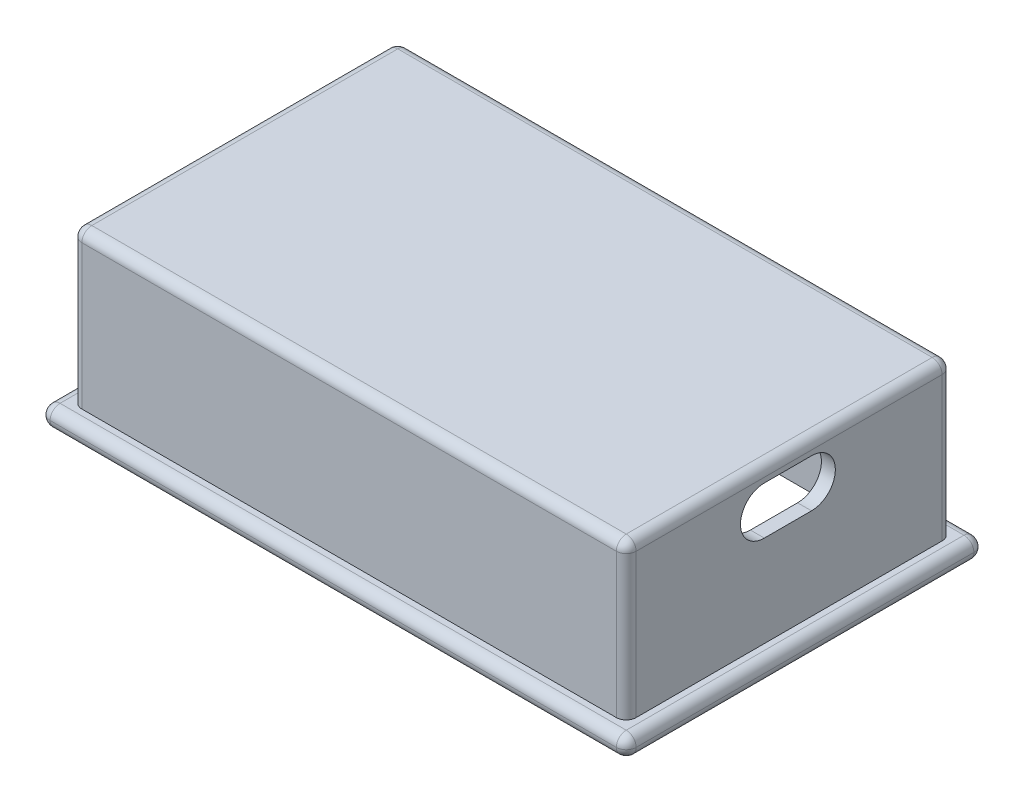
from build123d import *

# Parameters (mm, degrees)
SKETCH1_W           = 59
SKETCH1_H           = 36
BOSS_EXTRUDE1_DEPTH = 17.5
SKETCH2_W           = 53
SKETCH2_H           = 30
CUT_EXTRUDE1_DEPTH  = 15.9
SKETCH3_OUTSIDE_W   = 75.26
SKETCH3_OUTSIDE_H   = 52.26
SKETCH3_OUTSIDE_W_2 = 55.8
SKETCH3_OUTSIDE_H_2 = 32.8
CUT_EXTRUDE2_DEPTH  = 15.5
CUT_EXTRUDE3_DEPTH  = 1.4
FILLET1_R           = 1


with BuildPart() as part:
    # Sketch1 → Boss-Extrude1 (new body)
    with BuildSketch(Plane(origin=(0, 0, 0), x_dir=(1, 0, 0), z_dir=(0, 1, 0))):
        Rectangle(SKETCH1_W, SKETCH1_H)
    extrude(amount=BOSS_EXTRUDE1_DEPTH)

    # Sketch2 → Cut-Extrude1 (cut)
    with BuildSketch(Plane.XZ):
        Rectangle(SKETCH2_W, SKETCH2_H)
    extrude(amount=-CUT_EXTRUDE1_DEPTH, mode=Mode.SUBTRACT)

    # Sketch3 outside → Cut-Extrude2 (cut)
    with BuildSketch(Plane(origin=(0, 17.5, 0), x_dir=(1, 0, 0), z_dir=(0, 1, 0))):
        Rectangle(SKETCH3_OUTSIDE_W, SKETCH3_OUTSIDE_H)
        Rectangle(SKETCH3_OUTSIDE_W_2, SKETCH3_OUTSIDE_H_2, mode=Mode.SUBTRACT)
    extrude(amount=-CUT_EXTRUDE2_DEPTH, mode=Mode.SUBTRACT)

    # Sketch4 → Cut-Extrude3 (cut)
    with BuildSketch(Plane(origin=(27.9, 0, 0), x_dir=(0, 0, -1), z_dir=(1, 0, 0))):
        with BuildLine():
            Line((2.25, 16), (-2.5, 16))
            ThreePointArc((-2.5, 16), (-4.9, 13.6), (-2.5, 11.2))
            Line((-2.5, 11.2), (2.25, 11.2))
            ThreePointArc((2.25, 11.2), (4.65, 13.6), (2.25, 16))
        make_face()
    extrude(amount=-CUT_EXTRUDE3_DEPTH, mode=Mode.SUBTRACT)

    # Fillet1
    fillet1_edges = [part.edges().sort_by_distance(p)[0] for p in [
        (-29.5, 1, -18),
        (29.5, 1, -18),
        (0, 2, -18),
        (29.5, 1, 18),
        (-29.5, 1, 18),
        (-29.5, 2, 0),
        (0, 2, 18),
        (29.5, 2, 0),
        (-27.9, 17.5, 0),
        (-27.9, 9.75, -16.4),
        (0, 17.5, -16.4),
        (27.9, 9.75, -16.4),
        (27.9, 17.5, 0),
        (27.9, 9.75, 16.4),
        (0, 17.5, 16.4),
        (-27.9, 9.75, 16.4),
        (0, 0, -18),
        (29.5, 0, 0),
        (0, 0, 18),
        (-29.5, 0, 0),
    ]]
    fillet(fillet1_edges, radius=FILLET1_R - 0.0001)  # a hair under: the kernel refuses the full size


solid = part.part
